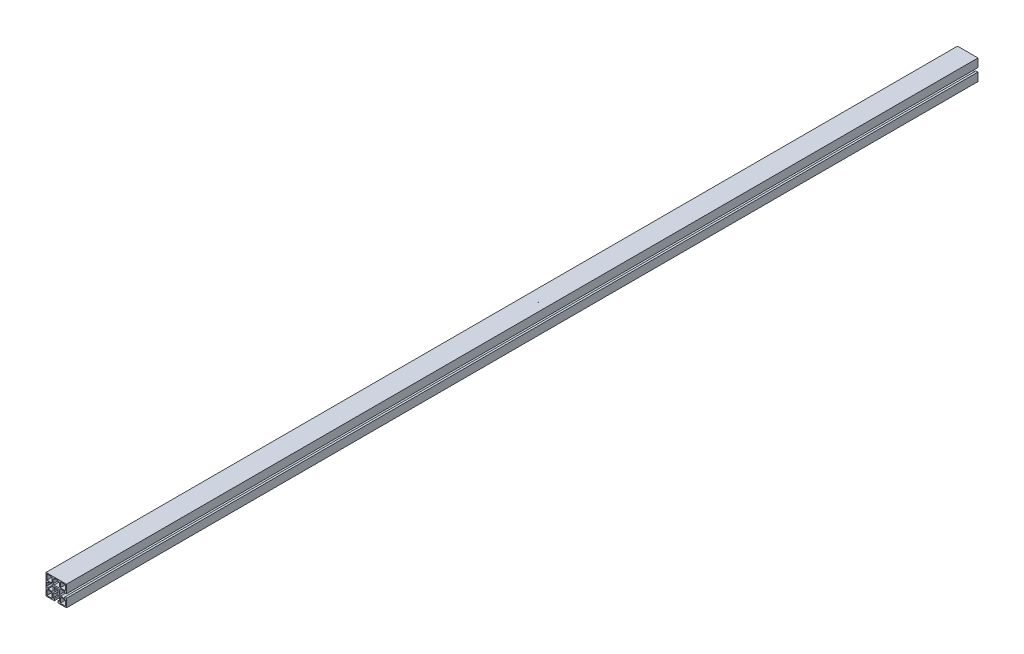
from build123d import *

# Parameters (mm, degrees)
SKETCH1_W           = 11.699975178
SKETCH1_H           = 11.699996949
SKETCH1_W_2         = 11.699990436
SKETCH1_H_2         = 11.699981689
SKETCH1_W_3         = 11.699990437
SKETCH1_H_3         = 11.699975177
SKETCH1_W_4         = 11.699981689
SKETCH1_H_4         = 11.699990436
BOSS_EXTRUDE1_DEPTH = 2002.028


with BuildPart() as part:
    # Sketch1 → Boss-Extrude1 (new body)
    with BuildSketch(Plane.XY):
        Polygon((22.500515052, 22.499297556), (-22.499484399, 22.499298105), (-22.499484948, -22.500701346), (-4.249491942, -22.500701568), (-4.249491942, -22.200733242), (-4.24949208, -18.000719999), (-6.799479919, -18.000719999), (-6.799480207, -9.200732353), (-4.799480391, -7.200732362), (4.800525817, -7.200732047), (6.8005258, -9.200731855), (6.800526088, -18.000720263), (4.250507877, -18.000720263), (4.250508015, -22.200733153), (4.250508015, -22.500701672), (22.500514502, -22.500701895), (22.500514725, -4.250714302), (22.200520351, -4.250714302), (18.000507108, -4.25071444), (18.000507108, -6.800702279), (9.200519462, -6.800702567), (7.200519471, -4.800702751), (7.200519156, 4.799303458), (9.200518964, 6.79930344), (18.000507424, 6.799303729), (18.000507424, 4.249285514), (22.200520261, 4.249285652), (22.500514829, 4.249285652), align=None)
        with BuildLine():
            Line((-4.249491247, 17.999291576), (-4.249490956, 22.199304807))
            Line((-4.249490956, 22.199304807), (-3.949472548, 22.199304807))
            Line((-3.949472548, 22.199304807), (-3.481695222, 21.73152644))
            ThreePointArc((-3.481695222, 21.73152644), (-2.670636178, 21.189593132), (-1.713926324, 20.999291428))
            Line((-1.713926324, 20.999291428), (1.714975167, 20.999291428))
            ThreePointArc((1.714975167, 20.999291428), (2.671722509, 21.189608628), (3.482801459, 21.731583767))
            Line((3.482801459, 21.731583767), (3.950490798, 22.199304487))
            Line((3.950490798, 22.199304487), (4.250509108, 22.199304487))
            Line((4.250509108, 22.199304487), (4.250508817, 17.999291575))
            Line((4.250508817, 17.999291575), (6.800527063, 17.999291575))
            Line((6.800527063, 17.999291575), (6.800526453, 9.199302988))
            Line((6.800526453, 9.199302988), (4.800526064, 7.199302969))
            Line((4.800526064, 7.199302969), (-4.799479817, 7.199303635))
            Line((-4.799479817, 7.199303635), (-6.799479854, 9.199304042))
            Line((-6.799479854, 9.199304042), (-6.799479244, 17.999291576))
            Line((-6.799479244, 17.999291576), (-4.249491247, 17.999291576))
        make_face(mode=Mode.SUBTRACT)
        with BuildLine():
            Line((-17.99949762, -4.250714253), (-22.199510799, -4.250714391))
            Line((-22.199510799, -4.250714391), (-22.199510799, -3.950696126))
            Line((-22.199510799, -3.950696126), (-21.731790056, -3.48300681))
            ThreePointArc((-21.731790056, -3.48300681), (-21.189814855, -2.671927844), (-20.999497617, -1.71518046))
            Line((-20.999497617, -1.71518046), (-20.999497617, 1.713721031))
            ThreePointArc((-20.999497617, 1.713721031), (-21.189799286, 2.670430863), (-21.731732544, 3.481489907))
            Line((-21.731732544, 3.481489907), (-22.199510888, 3.949267256))
            Line((-22.199510888, 3.949267256), (-22.199510888, 4.249285566))
            Line((-22.199510888, 4.249285566), (-17.999497356, 4.249285704))
            Line((-17.999497356, 4.249285704), (-17.999497356, 6.79927354))
            Line((-17.999497356, 6.79927354), (-9.199509947, 6.799273828))
            Line((-9.199509947, 6.799273828), (-7.199509956, 4.799274012))
            Line((-7.199509956, 4.799274012), (-7.199509641, -4.800732197))
            Line((-7.199509641, -4.800732197), (-9.199509449, -6.800732179))
            Line((-9.199509449, -6.800732179), (-17.99949762, -6.800732468))
            Line((-17.99949762, -6.800732468), (-17.99949762, -4.250714253))
        make_face(mode=Mode.SUBTRACT)
        with Locations((-14.649542346, -14.650709384)):
            Rectangle(SKETCH1_W, SKETCH1_H, mode=Mode.SUBTRACT)
        with Locations((14.65050626, -14.650767962)):
            Rectangle(SKETCH1_W_2, SKETCH1_H_2, mode=Mode.SUBTRACT)
        with BuildLine():
            Line((-3.181457266, -4.596908447), (-4.595670829, -3.182694885))
            Line((-4.595670829, -3.182694885), (-3.26221457, -1.849238626))
            ThreePointArc((-3.26221457, -1.849238626), (-3.749476751, -0.00071437), (-3.26221457, 1.847809887))
            Line((-3.26221457, 1.847809887), (-4.595670829, 3.181266146))
            Line((-4.595670829, 3.181266146), (-3.181457266, 4.595479708))
            Line((-3.181457266, 4.595479708), (-1.848001007, 3.262023449))
            ThreePointArc((-1.848001007, 3.262023449), (0.000523249, 3.74928563), (1.849047505, 3.262023449))
            Line((1.849047505, 3.262023449), (3.182503764, 4.595479708))
            Line((3.182503764, 4.595479708), (4.596717327, 3.181266146))
            Line((4.596717327, 3.181266146), (3.263261068, 1.847809887))
            ThreePointArc((3.263261068, 1.847809887), (3.750523249, -0.00071437), (3.263261068, -1.849238626))
            Line((3.263261068, -1.849238626), (4.596717327, -3.182694885))
            Line((4.596717327, -3.182694885), (3.182503764, -4.596908447))
            Line((3.182503764, -4.596908447), (1.849047505, -3.263452188))
            ThreePointArc((1.849047505, -3.263452188), (0.000523249, -3.75071437), (-1.848001007, -3.263452188))
            Line((-1.848001007, -3.263452188), (-3.181457266, -4.596908447))
        make_face(mode=Mode.SUBTRACT)
        with Locations((-14.64949028, 14.649335967)):
            Rectangle(SKETCH1_W_3, SKETCH1_H_3, mode=Mode.SUBTRACT)
        with Locations((14.650561583, 14.6492839)):
            Rectangle(SKETCH1_W_4, SKETCH1_H_4, mode=Mode.SUBTRACT)
    extrude(amount=BOSS_EXTRUDE1_DEPTH)


solid = part.part
